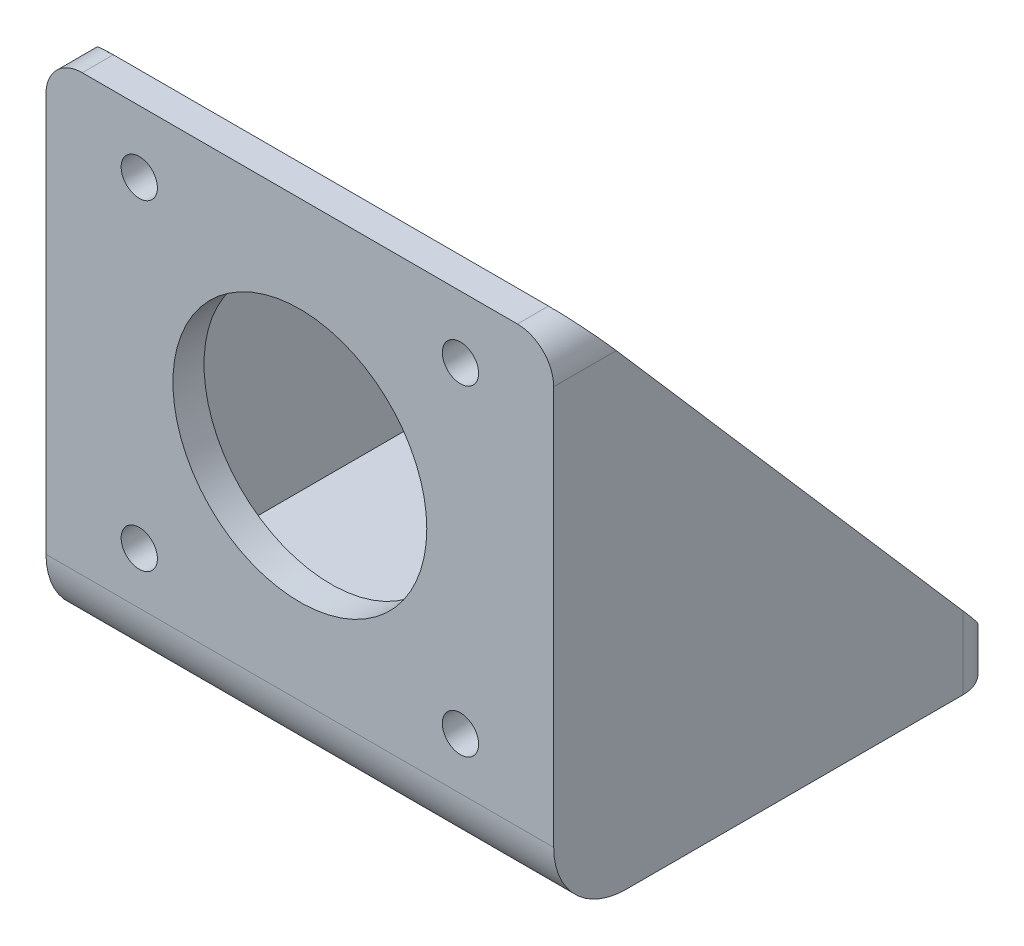
from build123d import *

# Parameters (mm, degrees)
ESBO_O1_W                = 43
ESBO_O1_H                = 43
RESSALTO_EXTRUS_O1_DEPTH = 3
ESBO_O2_W                = 43
ESBO_O2_H                = 3
RESSALTO_EXTRUS_O2_DEPTH = 46
ESBO_O3_R                = 1.75
CORTE_EXTRUS_O1_DEPTH    = 56.140729048
ESBO_O4_R                = 1.75
CORTE_EXTRUS_O2_DEPTH    = 69.645830172
RESSALTO_EXTRUS_O3_DEPTH = 3
RESSALTO_EXTRUS_O4_DEPTH = 3
ESBO_O7_R                = 12.25
CORTE_EXTRUS_O3_DEPTH    = 3
FILETE1_R                = 3.5
FILETE2_R                = 7
FILETE3_R                = 3.5
FILETE4_R                = 5
ESBO_O8_W                = 16
ESBO_O8_H                = 8
CORTE_EXTRUS_O4_DEPTH    = 57.378187353
FILETE5_R                = 1


with BuildPart() as part:
    # Esboço1 → Ressalto-extrusão1 (new body)
    with BuildSketch(Plane(origin=(0, 0, 0), x_dir=(1, 0, 0), z_dir=(0, 1, 0))):
        Rectangle(ESBO_O1_W, ESBO_O1_H)
    extrude(amount=RESSALTO_EXTRUS_O1_DEPTH)

    # Esboço2 → Ressalto-extrusão2 (add)
    with BuildSketch(Plane(origin=(0, 3, 0), x_dir=(1, 0, 0), z_dir=(0, 1, 0))):
        with Locations((0, -20)):
            Rectangle(ESBO_O2_W, ESBO_O2_H)
    extrude(amount=RESSALTO_EXTRUS_O2_DEPTH)

    # Esboço3 → Corte-extrusão1 (cut, through all)
    with BuildSketch(Plane(origin=(0, 3, 0), x_dir=(1, 0, 0), z_dir=(0, 1, 0))):
        with Locations(Location((14.945, 12.03, 0), (0, 0, 270))):
            Circle(ESBO_O3_R)
        with Locations(Location((14.945, -12.03, 0), (0, 0, 90))):
            Circle(ESBO_O3_R)
        with Locations(Location((-14.945, -12.03, 0), (0, 0, 270))):
            Circle(ESBO_O3_R)
        with Locations(Location((-14.945, 12.03, 0), (0, 0, 90))):
            Circle(ESBO_O3_R)
    extrude(amount=-CORTE_EXTRUS_O1_DEPTH, mode=Mode.SUBTRACT)

    # Esboço4 → Corte-extrusão2 (cut, through all)
    with BuildSketch(Plane.XY.offset(21.5)):
        with Locations((-15.5, 43)):
            Circle(ESBO_O4_R)
        with Locations((15.5, 43)):
            Circle(ESBO_O4_R)
        with Locations((-15.5, 12)):
            Circle(ESBO_O4_R)
        with Locations((15.5, 12)):
            Circle(ESBO_O4_R)
    extrude(amount=-CORTE_EXTRUS_O2_DEPTH, mode=Mode.SUBTRACT)

    # Esboço5 → Ressalto-extrusão3 (add)
    with BuildSketch(Plane.ZY.offset(21.5)):
        Polygon((-21.5, 0), (-21.5, 3), (18.5, 49), (21.5, 49), (21.5, 0), align=None)
    extrude(amount=RESSALTO_EXTRUS_O3_DEPTH)

    # Esboço6 → Ressalto-extrusão4 (add)
    with BuildSketch(Plane(origin=(21.5, 0, 0), x_dir=(0, 0, -1), z_dir=(1, 0, 0))):
        Polygon((21.5, 0), (-21.5, 0), (-21.5, 49), (-18.5, 49), (21.5, 3), align=None)
    extrude(amount=RESSALTO_EXTRUS_O4_DEPTH)

    # Esboço7 → Corte-extrusão3 (cut)
    with BuildSketch(Plane.XY.offset(21.5)):
        with Locations((0, 27.5)):
            Circle(ESBO_O7_R)
    extrude(amount=-CORTE_EXTRUS_O3_DEPTH, mode=Mode.SUBTRACT)

    # Filete1
    # the kernel refuses this fillet: 3.5 mm, written as the material it takes off along each edge
    with BuildSketch(Plane(origin=(-24.5, 49, 9.75), x_dir=(1, 0, 0), z_dir=(0, 0, 1)), Plane(origin=(24.5, 49, 30.25), x_dir=(-1, 0, 0), z_dir=(0, 0, -1))) as filete1_piece_1:
        with BuildLine():
            CenterArc((FILETE1_R, -FILETE1_R), FILETE1_R, 90, 90)
            Line((0, -FILETE1_R), (0, 0))
            Line((0, 0), (FILETE1_R, 0))
        make_face()
    extrude(amount=20.5, mode=Mode.SUBTRACT)

    # Filete2
    filete2_edges = [part.edges().sort_by_distance(p)[0] for p in [
        (0, 0, 21.5),
    ]]
    fillet(filete2_edges, radius=FILETE2_R)

    # Filete3
    # the kernel refuses this fillet: 3.5 mm, written as the material it takes off along each edge
    with BuildSketch(Plane(origin=(-24.5, -8.75, -21.5), x_dir=(0, 0, 1), z_dir=(0, 1, 0)), Plane(origin=(24.5, 11.75, -21.5), x_dir=(0, 0, 1), z_dir=(0, -1, 0))) as filete3_piece_1:
        with BuildLine():
            CenterArc((FILETE3_R, FILETE3_R), FILETE3_R, 180, 90)
            Line((0, FILETE3_R), (0, 0))
            Line((0, 0), (FILETE3_R, 0))
        make_face()
    extrude(amount=20.5, mode=Mode.SUBTRACT)

    # Filete4
    filete4_edges = [part.edges().sort_by_distance(p)[0] for p in [
        (0, 3, 18.5),
    ]]
    fillet(filete4_edges, radius=FILETE4_R)

    # Esboço8 → Corte-extrusão4 (cut, through all)
    with BuildSketch(Plane(origin=(0, 3, 0), x_dir=(1, 0, 0), z_dir=(0, 1, 0))):
        with Locations((0, 17.5)):
            Rectangle(ESBO_O8_W, ESBO_O8_H)
    extrude(amount=-CORTE_EXTRUS_O4_DEPTH, mode=Mode.SUBTRACT)

    # Filete5
    filete5_edges = [part.edges().sort_by_distance(p)[0] for p in [
        (-8, 1.5, -21.5),
        (8, 1.5, -21.5),
        (8, 1.5, -13.5),
        (-8, 1.5, -13.5),
    ]]
    fillet(filete5_edges, radius=FILETE5_R)


solid = part.part
